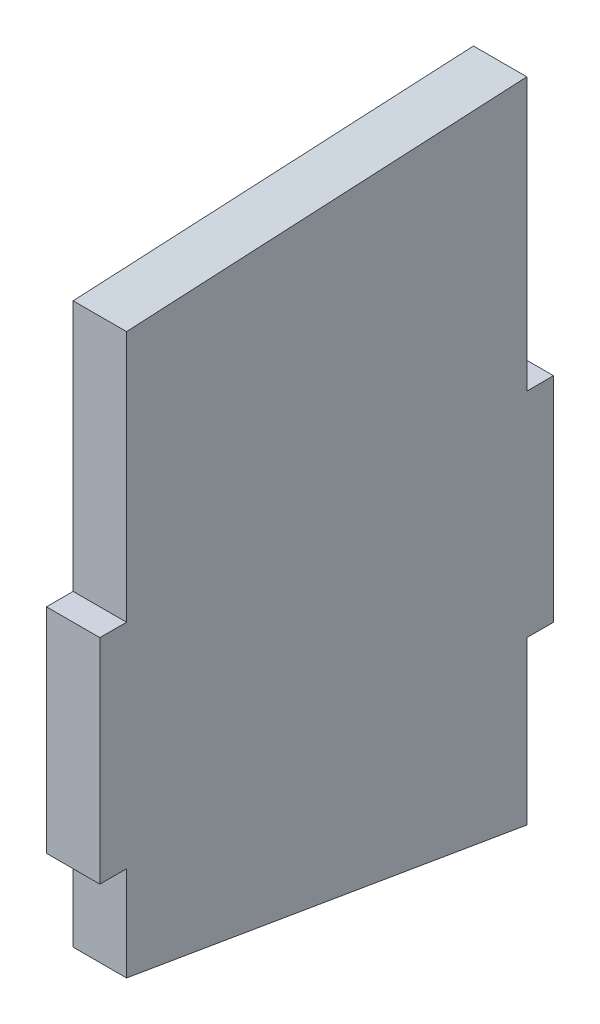
from build123d import *

# Parameters (mm, degrees)
BOSS_EXTRUDE1_DEPTH = 25.4


with BuildPart() as part:
    # Sketch1 → Boss-Extrude1 (new body)
    with BuildSketch(Plane(origin=(0, 0, 0), x_dir=(0, 0, -1), z_dir=(1, 0, 0))):
        Polygon((95.25, 180.323740444), (-95.25, 170.563269744), (-95.25, 50.8), (-107.95, 50.8), (-107.95, -50.8), (-95.25, -50.8), (-95.25, -95.823816988), (95.25, -128.029563346), (95.25, -50.8), (107.95, -50.8), (107.95, 50.8), (95.25, 50.8), align=None)
    extrude(amount=BOSS_EXTRUDE1_DEPTH)


solid = part.part
